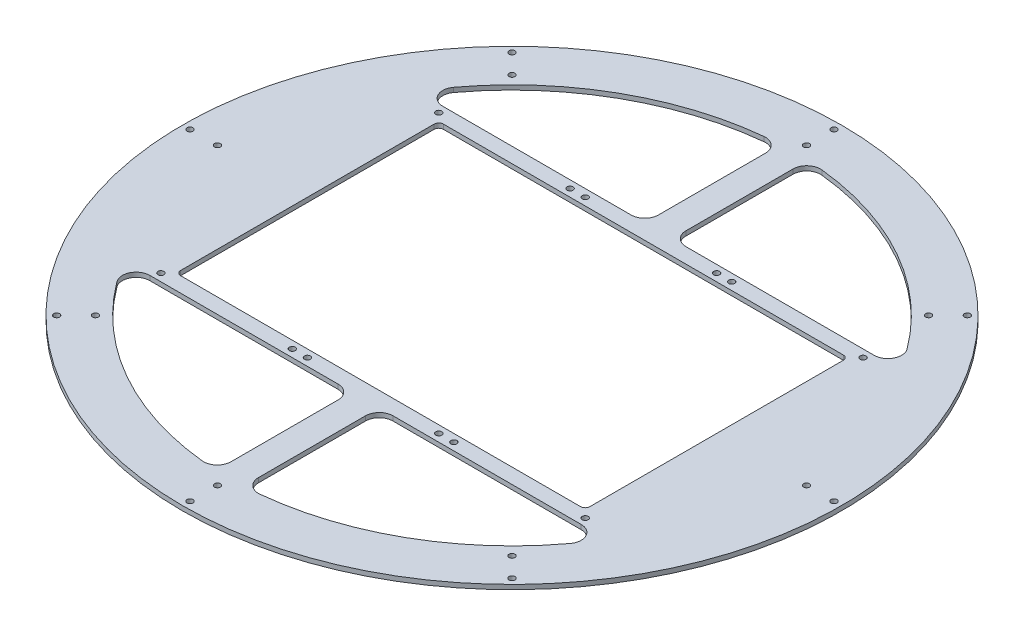
from build123d import *

# Parameters (mm, degrees)
BOSS_EXTRUDE1_OUTLINE_R   = 228.6
BOSS_EXTRUDE1_OUTLINE_R_2 = 2.0701
BOSS_EXTRUDE1_DEPTH       = 3.175
SKETCH3_W                 = 283.8196
SKETCH3_H                 = 182.2196
SKETCH3_R                 = 2.0701
CUT_EXTRUDE1_DEPTH        = 324.304810705
FILLET1_R                 = 3.175
CUT_EXTRUDE2_DEPTH        = 324.304810705
FILLET2_R                 = 9.525


# Read off the part's stored shape, not the designer's step: Boss-Extrude1
with BuildPart() as part:
    # Boss-Extrude1 outline → Boss-Extrude1 (new body)
    with BuildSketch(Plane(origin=(0, 0, 0), x_dir=(1, 0, 0), z_dir=(0, 1, 0))):
        Circle(BOSS_EXTRUDE1_OUTLINE_R)
        with Locations((-157.935764401, -157.935764401)):
            Circle(BOSS_EXTRUDE1_OUTLINE_R_2, mode=Mode.SUBTRACT)
        with Locations((-144.46538022, -144.46538022)):
            Circle(BOSS_EXTRUDE1_OUTLINE_R_2, mode=Mode.SUBTRACT)
        with Locations((0, -223.3549)):
            Circle(BOSS_EXTRUDE1_OUTLINE_R_2, mode=Mode.SUBTRACT)
        with Locations((0, -204.3049)):
            Circle(BOSS_EXTRUDE1_OUTLINE_R_2, mode=Mode.SUBTRACT)
        with Locations((157.935764401, -157.935764401)):
            Circle(BOSS_EXTRUDE1_OUTLINE_R_2, mode=Mode.SUBTRACT)
        with Locations((144.46538022, -144.46538022)):
            Circle(BOSS_EXTRUDE1_OUTLINE_R_2, mode=Mode.SUBTRACT)
        with Locations((-223.3549, 0)):
            Circle(BOSS_EXTRUDE1_OUTLINE_R_2, mode=Mode.SUBTRACT)
        with Locations((-204.3049, 0)):
            Circle(BOSS_EXTRUDE1_OUTLINE_R_2, mode=Mode.SUBTRACT)
        with Locations((-144.46538022, 144.46538022)):
            Circle(BOSS_EXTRUDE1_OUTLINE_R_2, mode=Mode.SUBTRACT)
        with Locations((-157.935764401, 157.935764401)):
            Circle(BOSS_EXTRUDE1_OUTLINE_R_2, mode=Mode.SUBTRACT)
        with Locations((204.3049, 0)):
            Circle(BOSS_EXTRUDE1_OUTLINE_R_2, mode=Mode.SUBTRACT)
        with Locations((223.3549, 0)):
            Circle(BOSS_EXTRUDE1_OUTLINE_R_2, mode=Mode.SUBTRACT)
        with Locations((0, 204.3049)):
            Circle(BOSS_EXTRUDE1_OUTLINE_R_2, mode=Mode.SUBTRACT)
        with Locations((0, 223.3549)):
            Circle(BOSS_EXTRUDE1_OUTLINE_R_2, mode=Mode.SUBTRACT)
        with Locations((144.46538022, 144.46538022)):
            Circle(BOSS_EXTRUDE1_OUTLINE_R_2, mode=Mode.SUBTRACT)
        with Locations((157.935764401, 157.935764401)):
            Circle(BOSS_EXTRUDE1_OUTLINE_R_2, mode=Mode.SUBTRACT)
    extrude(amount=BOSS_EXTRUDE1_DEPTH)

    # Sketch3 → Cut-Extrude1 (cut, through all)
    with BuildSketch(Plane.XZ):
        Rectangle(SKETCH3_W, SKETCH3_H)
        with Locations(Location((147.1549, -96.3549, 0), (0, 0, 270))):
            Circle(SKETCH3_R)
        with Locations(Location((56.0451, -96.3549, 0), (0, 0, 270))):
            Circle(SKETCH3_R)
        with Locations(Location((45.5549, -96.3549, 0), (0, 0, 90))):
            Circle(SKETCH3_R)
        with Locations(Location((-45.5549, -96.3549, 0), (0, 0, 90))):
            Circle(SKETCH3_R)
        with Locations(Location((-56.0451, -96.3549, 0), (0, 0, 270))):
            Circle(SKETCH3_R)
        with Locations(Location((-147.1549, -96.3549, 0), (0, 0, 270))):
            Circle(SKETCH3_R)
        with Locations(Location((-147.1549, 96.3549, 0), (0, 0, 90))):
            Circle(SKETCH3_R)
        with Locations(Location((-56.0451, 96.3549, 0), (0, 0, 90))):
            Circle(SKETCH3_R)
        with Locations(Location((-45.5549, 96.3549, 0), (0, 0, 270))):
            Circle(SKETCH3_R)
        with Locations(Location((45.5549, 96.3549, 0), (0, 0, 270))):
            Circle(SKETCH3_R)
        with Locations(Location((56.0451, 96.3549, 0), (0, 0, 90))):
            Circle(SKETCH3_R)
        with Locations(Location((147.1549, 96.3549, 0), (0, 0, 90))):
            Circle(SKETCH3_R)
    extrude(amount=-CUT_EXTRUDE1_DEPTH, mode=Mode.SUBTRACT)

    # Fillet1
    fillet1_edges = [part.edges().sort_by_distance(p)[0] for p in [
        (-141.9098, 1.5875, -91.1098),
        (-141.9098, 1.5875, 91.1098),
        (141.9098, 1.5875, 91.1098),
        (141.9098, 1.5875, -91.1098),
    ]]
    fillet(fillet1_edges, radius=FILLET1_R)

    # Sketch4 → Cut-Extrude2 (cut, through all)
    with BuildSketch(Plane.XZ):
        with BuildLine():
            Line((-9.525, -195.653083917), (-9.525, -101.6))
            Line((-9.525, -101.6), (-167.476251663, -101.6))
            ThreePointArc((-167.476251663, -101.6), (-100.219042208, -168.306263846), (-9.525, -195.653083917))
        make_face()
        with BuildLine():
            Line((167.476251663, -101.6), (9.525, -101.6))
            Line((9.525, -101.6), (9.525, -195.653083917))
            ThreePointArc((9.525, -195.653083917), (100.219042208, -168.306263846), (167.476251663, -101.6))
        make_face()
        with BuildLine():
            Line((9.525, 101.6), (167.476251663, 101.6))
            ThreePointArc((167.476251663, 101.6), (100.219042208, 168.306263846), (9.525, 195.653083917))
            Line((9.525, 195.653083917), (9.525, 101.6))
        make_face()
        with BuildLine():
            ThreePointArc((-9.525, 195.653083917), (-100.219042208, 168.306263846), (-167.476251663, 101.6))
            Line((-167.476251663, 101.6), (-9.525, 101.6))
            Line((-9.525, 101.6), (-9.525, 195.653083917))
        make_face()
    extrude(amount=-CUT_EXTRUDE2_DEPTH, mode=Mode.SUBTRACT)

    # Fillet2
    fillet2_edges = [part.edges().sort_by_distance(p)[0] for p in [
        (-167.476251663, 1.5875, -101.6),
        (-9.525, 1.5875, -101.6),
        (-9.525, 1.5875, -195.653083917),
        (9.525, 1.5875, -195.653083917),
        (9.525, 1.5875, -101.6),
        (167.476251663, 1.5875, -101.6),
        (167.476251663, 1.5875, 101.6),
        (9.525, 1.5875, 101.6),
        (9.525, 1.5875, 195.653083917),
        (-9.525, 1.5875, 195.653083917),
        (-9.525, 1.5875, 101.6),
        (-167.476251663, 1.5875, 101.6),
    ]]
    fillet(fillet2_edges, radius=FILLET2_R)


solid = part.part
